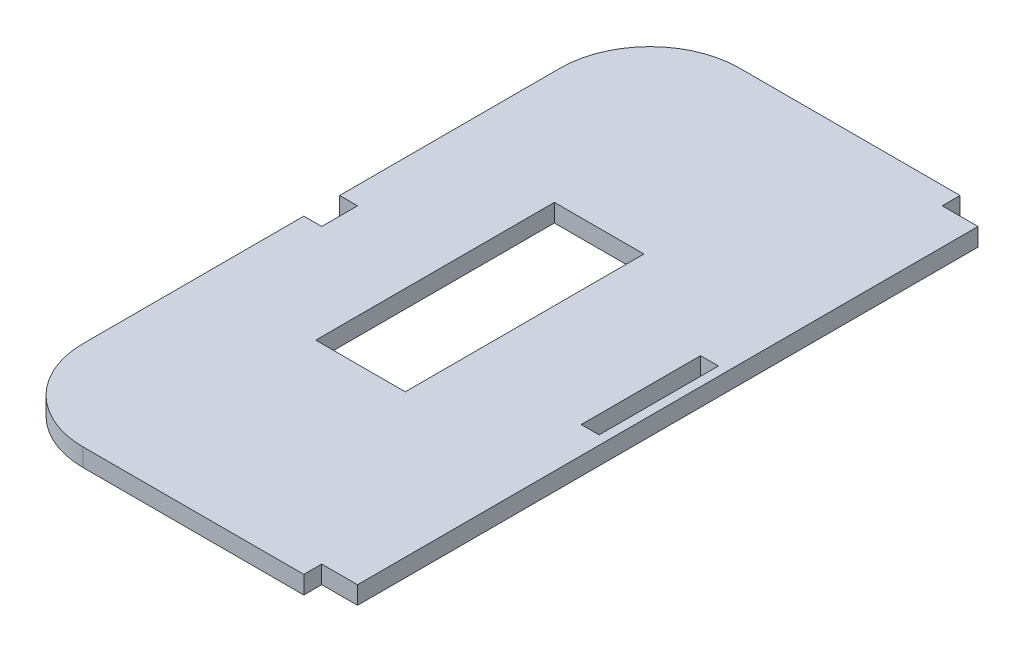
from build123d import *

# Parameters (mm, degrees)
EXTRUDE_3_DEPTH    = 3
SKETCH1_W          = 15
SKETCH1_H          = 40
SKETCH1_W_2        = 3
SKETCH1_H_2        = 20
CUT_EXTRUDE1_DEPTH = 10
FILLET1_R          = 15


with BuildPart() as part:
    # Эскиз4 → Бобышка-Вытянуть3 (new body)
    with BuildSketch(Plane(origin=(0, 0, 0), x_dir=(1, 0, 0), z_dir=(0, 1, 0))):
        Polygon((0, 52), (0, 0), (52, 0), (52, 3), (55, 3), (58, 3), (58, 107), (55, 107), (52, 107), (52, 110), (0, 110), (0, 58), (3, 58), (3, 55), (3, 52), align=None)
    extrude(amount=EXTRUDE_3_DEPTH)

    # Sketch1 → Cut-Extrude1 (cut)
    with BuildSketch(Plane(origin=(0, 3, 0), x_dir=(1, 0, 0), z_dir=(0, 1, 0))):
        with Locations((26.5, 55)):
            Rectangle(SKETCH1_W, SKETCH1_H)
        with Locations((55, 55)):
            Rectangle(SKETCH1_W_2, SKETCH1_H_2)
    extrude(amount=-CUT_EXTRUDE1_DEPTH, mode=Mode.SUBTRACT)

    # Fillet1
    fillet1_edges = [part.edges().sort_by_distance(p)[0] for p in [
        (0, 1.5, 0),
        (0, 1.5, -110),
    ]]
    fillet(fillet1_edges, radius=FILLET1_R)


solid = part.part
